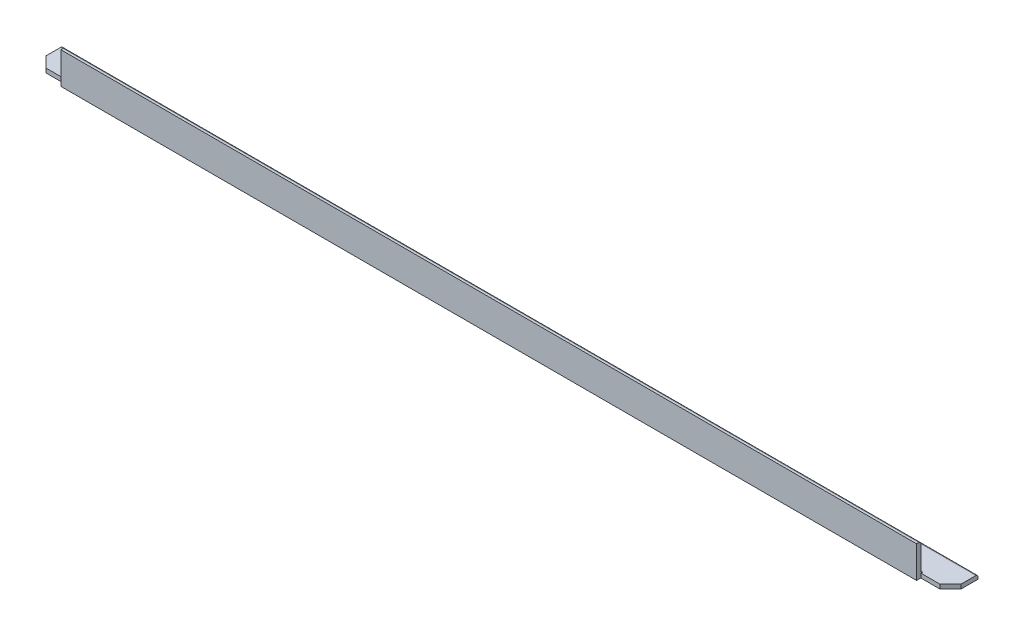
from build123d import *

# Parameters (mm, degrees)
EXTRUDE_1_DEPTH     = 432
CUT_EXTRUDE_5_DEPTH = 14
CUT_EXTRUDE_6_DEPTH = 14
CUT_EXTRUDE_7_DEPTH = 433.455778086
SKETCH_10_R         = 2.3
CUT_EXTRUDE_8_DEPTH = 433.455778086
CHAMFER_1_SIZE      = 2.05


with BuildPart() as part:
    # Эскиз1 → Бобышка-Вытянуть1 (new body)
    with BuildSketch(Plane(origin=(0, 0, 0), x_dir=(0, 0, -1), z_dir=(1, 0, 0))):
        with BuildLine():
            Line((0, 0), (0, 15))
            Line((0, 15), (1, 15))
            ThreePointArc((1, 15), (1.707106781, 14.707106781), (2, 14))
            Line((2, 14), (2, 3))
            ThreePointArc((2, 3), (2.292893219, 2.292893219), (3, 2))
            Line((3, 2), (14, 2))
            ThreePointArc((14, 2), (14.707106781, 1.707106781), (15, 1))
            Line((15, 1), (15, 0))
            Line((15, 0), (0, 0))
        make_face()
    extrude(amount=EXTRUDE_1_DEPTH)

    # Эскиз6 → Вырез-Вытянуть5 (cut)
    with BuildSketch(Plane(origin=(432, 0, 0), x_dir=(0, 0, -1), z_dir=(1, 0, 0))):
        Polygon((0, 15), (2, 15), (3, 15), (3, 2), (2, 2), (2, 0), (0, 0), align=None)
    extrude(amount=-CUT_EXTRUDE_5_DEPTH, mode=Mode.SUBTRACT)

    # Эскиз7 → Вырез-Вытянуть6 (cut)
    with BuildSketch(Plane.ZY):
        Polygon((0, 15), (-2, 15), (-3, 15), (-3, 2), (-2, 2), (-2, 0), (0, 0), align=None)
    extrude(amount=-CUT_EXTRUDE_6_DEPTH, mode=Mode.SUBTRACT)

    # Эскиз9 → Вырез-Вытянуть7 (cut, through all)
    with BuildSketch(Plane(origin=(0, 2, 0), x_dir=(1, 0, 0), z_dir=(0, 1, 0))):
        Polygon((0, 2), (0, 7), (5, 2), align=None)
        Polygon((432, 2), (432, 7), (427, 2), align=None)
    extrude(amount=-CUT_EXTRUDE_7_DEPTH, mode=Mode.SUBTRACT)

    # Эскиз10 → Вырез-Вытянуть8 (cut, through all)
    with BuildSketch(Plane(origin=(0, 2, 0), x_dir=(1, 0, 0), z_dir=(0, 1, 0))):
        with Locations(Location((40, 8, 0), (0, 0, 270))):
            Circle(SKETCH_10_R)
        with Locations(Location((392, 8, 0), (0, 0, 270))):
            Circle(SKETCH_10_R)
    extrude(amount=-CUT_EXTRUDE_8_DEPTH, mode=Mode.SUBTRACT)

    # Фаска1
    # the kernel refuses this chamfer: 2.05 mm, written as the material it takes off along each edge
    with BuildSketch(Plane(origin=(40, 2, -8), x_dir=(0, 0, 1), z_dir=(-1, 0, 0))) as chamfer_1_piece_1:
        Polygon((2.3 + CHAMFER_1_SIZE, 0), (2.3, -CHAMFER_1_SIZE), (2.3, 0), align=None)
    revolve(axis=Axis((40, 2, -8), (0, 1, 0)), mode=Mode.SUBTRACT)
    with BuildSketch(Plane(origin=(392, 2, -8), x_dir=(0, 0, 1), z_dir=(-1, 0, 0))) as chamfer_1_piece_2:
        Polygon((2.3 + CHAMFER_1_SIZE, 0), (2.3, -CHAMFER_1_SIZE), (2.3, 0), align=None)
    revolve(axis=Axis((392, 2, -8), (0, 1, 0)), mode=Mode.SUBTRACT)


solid = part.part
